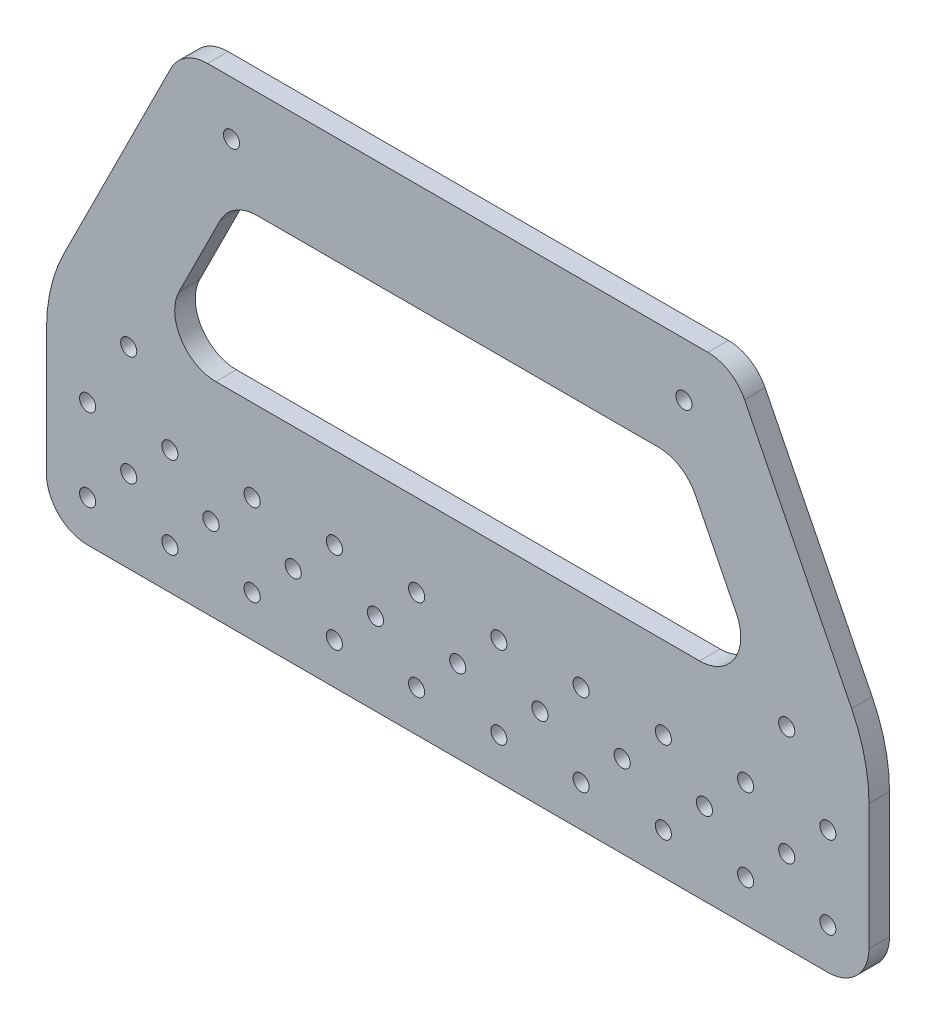
from build123d import *

# Parameters (mm, degrees)
BOSS_EXTRUDE1_DEPTH = 6.35
SKETCH2_R           = 2.4892
CUT_EXTRUDE1_DEPTH  = 294.699684882
SKETCH3_R           = 2.4892
CUT_EXTRUDE2_DEPTH  = 294.699684882


with BuildPart() as part:
    # Sketch1 → Boss-Extrude1 (new body)
    with BuildSketch(Plane.XY):
        with BuildLine():
            ThreePointArc((0, 12.7), (3.719743879, 3.719743879), (12.7, 0))
            Line((12.7, 0), (241.3, 0))
            ThreePointArc((241.3, 0), (250.280256121, 3.719743879), (254, 12.7))
            Line((254, 12.7), (254, 51.507746743))
            ThreePointArc((254, 51.507746743), (252.641048665, 63.179195107), (248.636901303, 74.226197394))
            Line((248.636901303, 74.226197394), (215.600193669, 140.299612663))
            ThreePointArc((215.600193669, 140.299612663), (210.917753467, 145.423265266), (204.240968343, 147.32))
            Line((204.240968343, 147.32), (49.759031657, 147.32))
            ThreePointArc((49.759031657, 147.32), (43.082246533, 145.423265266), (38.399806331, 140.299612663))
            Line((38.399806331, 140.299612663), (5.363098697, 74.226197394))
            ThreePointArc((5.363098697, 74.226197394), (1.358951335, 63.179195107), (0, 51.507746743))
            Line((0, 51.507746743), (0, 12.7))
        make_face()
        with BuildLine():
            ThreePointArc((52.299031657, 63.5), (41.495766391, 69.523214876), (40.939806331, 81.879612663))
            Line((40.939806331, 81.879612663), (53.639806331, 107.279612663))
            ThreePointArc((53.639806331, 107.279612663), (58.322246533, 112.403265266), (64.999031657, 114.3))
            Line((64.999031657, 114.3), (189.000968343, 114.3))
            ThreePointArc((189.000968343, 114.3), (195.677753467, 112.403265266), (200.360193669, 107.279612663))
            Line((200.360193669, 107.279612663), (213.060193669, 81.879612663))
            ThreePointArc((213.060193669, 81.879612663), (212.504233609, 69.523214876), (201.700968343, 63.5))
            Line((201.700968343, 63.5), (196.85, 63.5))
            Line((196.85, 63.5), (57.15, 63.5))
            Line((57.15, 63.5), (52.299031657, 63.5))
        make_face(mode=Mode.SUBTRACT)
    extrude(amount=BOSS_EXTRUDE1_DEPTH)

    # Sketch2 → Cut-Extrude1 (cut, through all)
    with BuildSketch(Plane.XY.offset(6.35)):
        with Locations((241.3, 12.7)):
            Circle(SKETCH2_R)
        with Locations((215.9, 12.7)):
            Circle(SKETCH2_R)
        with Locations((190.5, 12.7)):
            Circle(SKETCH2_R)
        with Locations((165.1, 12.7)):
            Circle(SKETCH2_R)
        with Locations((139.7, 12.7)):
            Circle(SKETCH2_R)
        with Locations((114.3, 12.7)):
            Circle(SKETCH2_R)
        with Locations((88.9, 12.7)):
            Circle(SKETCH2_R)
        with Locations((63.5, 12.7)):
            Circle(SKETCH2_R)
        with Locations((38.1, 12.7)):
            Circle(SKETCH2_R)
        with Locations((12.7, 12.7)):
            Circle(SKETCH2_R)
        with Locations((215.9, 38.1)):
            Circle(SKETCH2_R)
        with Locations((190.5, 38.1)):
            Circle(SKETCH2_R)
        with Locations((165.1, 38.1)):
            Circle(SKETCH2_R)
        with Locations((139.7, 38.1)):
            Circle(SKETCH2_R)
        with Locations((114.3, 38.1)):
            Circle(SKETCH2_R)
        with Locations((88.9, 38.1)):
            Circle(SKETCH2_R)
        with Locations((63.5, 38.1)):
            Circle(SKETCH2_R)
        with Locations((38.1, 38.1)):
            Circle(SKETCH2_R)
        with Locations((12.7, 38.1)):
            Circle(SKETCH2_R)
        with Locations((241.3, 38.1)):
            Circle(SKETCH2_R)
        with Locations((25.4, 25.4)):
            Circle(SKETCH2_R)
        with Locations((50.8, 25.4)):
            Circle(SKETCH2_R)
        with Locations((76.2, 25.4)):
            Circle(SKETCH2_R)
        with Locations((101.6, 25.4)):
            Circle(SKETCH2_R)
        with Locations((127, 25.4)):
            Circle(SKETCH2_R)
        with Locations((152.4, 25.4)):
            Circle(SKETCH2_R)
        with Locations((177.8, 25.4)):
            Circle(SKETCH2_R)
        with Locations((203.2, 25.4)):
            Circle(SKETCH2_R)
        with Locations((228.6, 25.4)):
            Circle(SKETCH2_R)
    extrude(amount=-CUT_EXTRUDE1_DEPTH, mode=Mode.SUBTRACT)

    # Sketch3 → Cut-Extrude2 (cut, through all)
    with BuildSketch(Plane.XY.offset(6.35)):
        with Locations((25.4, 59.332735968)):
            Circle(SKETCH3_R)
        with Locations((57.15, 130.81)):
            Circle(SKETCH3_R)
        with Locations((196.85, 130.81)):
            Circle(SKETCH3_R)
        with Locations((228.6, 59.332735968)):
            Circle(SKETCH3_R)
    extrude(amount=-CUT_EXTRUDE2_DEPTH, mode=Mode.SUBTRACT)


solid = part.part
